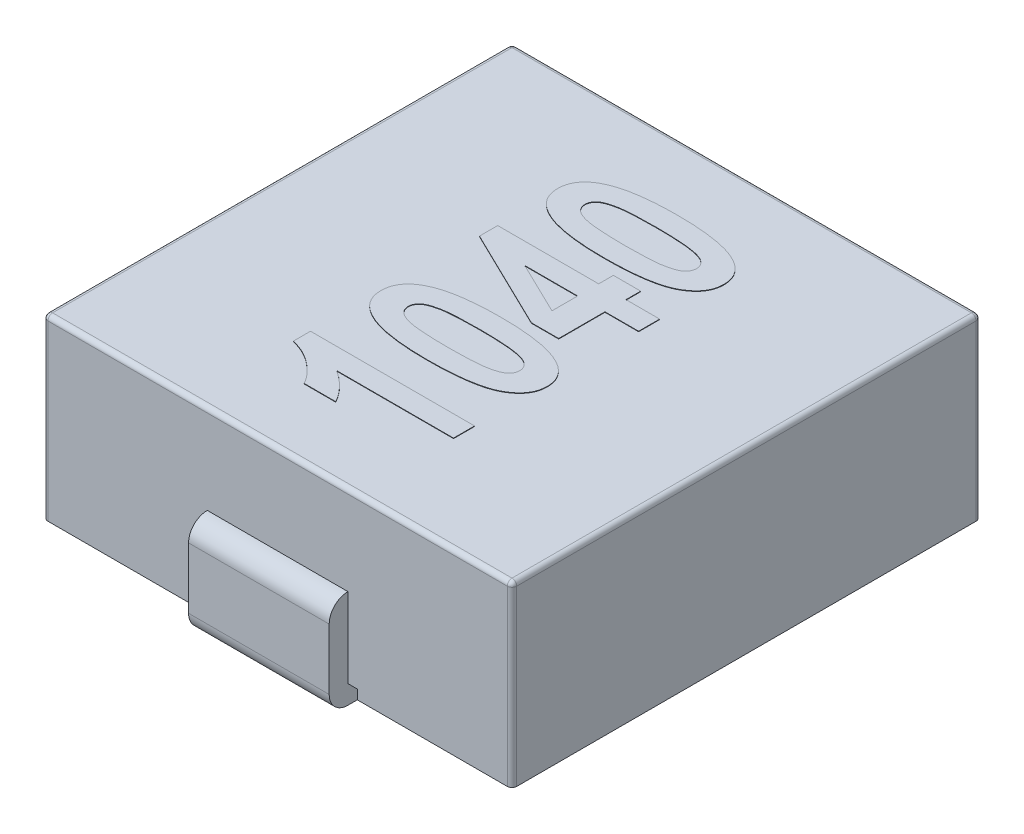
from build123d import *

# Parameters (mm, degrees)
EXTRUDE_1_DEPTH     = 3.8
SKETCH_2_W          = 3.4
SKETCH_2_H          = 2.5
CUT_EXTRUDE_1_DEPTH = 0.2
EXTRUDE_START       = -1.5
EXTRUDE_1_2_DEPTH   = 3
EXTRUDE_2_DEPTH     = 1.5
FILLET_1_R          = 0.1
EXTRUDE_2_2_DEPTH   = 0.01


# Read off the part's stored shape, not the designer's step: Вытянуть-Тонкостенный1
with BuildPart() as part:
    # Эскиз1 → Extrude 1 (new body)
    with BuildSketch(Plane(origin=(0, 0, 0), x_dir=(1, 0, 0), z_dir=(0, 1, 0))):
        with BuildLine():
            Line((-4.9, -5), (4.9, -5))
            ThreePointArc((4.9, -5), (4.970710678, -4.970710678), (5, -4.9))
            Line((5, -4.9), (5, 4.9))
            ThreePointArc((5, 4.9), (4.970710678, 4.970710678), (4.9, 5))
            Line((4.9, 5), (-4.9, 5))
            ThreePointArc((-4.9, 5), (-4.970710678, 4.970710678), (-5, 4.9))
            Line((-5, 4.9), (-5, -4.9))
            ThreePointArc((-5, -4.9), (-4.970710678, -4.970710678), (-4.9, -5))
        make_face()
    extrude(amount=EXTRUDE_1_DEPTH)

    # Эскиз2 → Вырез-Вытянуть1 (cut)
    with BuildSketch(Plane.XZ):
        with Locations((0, 3.75)):
            Rectangle(SKETCH_2_W, SKETCH_2_H)
        with Locations((0, -3.75)):
            Rectangle(SKETCH_2_W, SKETCH_2_H)
    extrude(amount=-CUT_EXTRUDE_1_DEPTH, mode=Mode.SUBTRACT)

    # Extrude 1 2 outline → Extrude 1 2 (add)
    with BuildSketch(Plane(origin=(0, 0, 0), x_dir=(0, 0, -1), z_dir=(1, 0, 0)).offset(EXTRUDE_START)):
        with BuildLine():
            Line((-5, -0.2), (-2.8, -0.2))
            Line((-2.8, -0.2), (-2.8, 0.2))
            Line((-2.8, 0.2), (-5, 0.2))
            Line((-5, 0.2), (-5, 1.9))
            ThreePointArc((-5, 1.9), (-5.282842712, 1.782842712), (-5.4, 1.5))
            Line((-5.4, 1.5), (-5.4, 0.2))
            ThreePointArc((-5.4, 0.2), (-5.282842712, -0.082842712), (-5, -0.2))
        make_face()
    extrude(amount=EXTRUDE_1_2_DEPTH)

    # Эскиз3<3> → Extrude 2 (add, symmetric)
    with BuildSketch(Plane(origin=(0, 0, 0), x_dir=(0, 0, -1), z_dir=(1, 0, 0))):
        with BuildLine():
            ThreePointArc((5, 1.9), (5.282842712, 1.782842712), (5.4, 1.5))
            Line((5.4, 1.5), (5.4, 0.2))
            ThreePointArc((5.4, 0.2), (5.282842712, -0.082842712), (5, -0.2))
            Line((5, -0.2), (2.8, -0.2))
            Line((2.8, -0.2), (2.8, 0.1))
            Line((2.8, 0.1), (5, 0.1))
            ThreePointArc((5, 0.1), (5.070710678, 0.129289322), (5.1, 0.2))
            Line((5.1, 0.2), (5.1, 1.5))
            ThreePointArc((5.1, 1.5), (5.070710678, 1.570710678), (5, 1.6))
            Line((5, 1.6), (5, 1.9))
        make_face()
    extrude(amount=EXTRUDE_2_DEPTH, both=True)

    # Скругление1
    fillet_1_edges = [part.edges().sort_by_distance(p)[0] for p in [
        (4.970710678, 3.8, 4.970710678),
        (5, 3.8, 0),
        (4.970710678, 3.8, -4.970710678),
        (0, 3.8, -5),
        (-4.970710678, 3.8, -4.970710678),
        (-5, 3.8, 0),
        (-4.970710678, 3.8, 4.970710678),
        (0, 3.8, 5),
    ]]
    fillet(fillet_1_edges, radius=FILLET_1_R)

    # Эскиз4 → Extrude 2 2 (add)
    # profile 1 of 4: a face of its own
    with BuildSketch(Plane(origin=(0, 3.8, 0), x_dir=(1, 0, 0), z_dir=(0, 1, 0))):
        with BuildLine():
            Line((1.7, -2.498717949), (1.7, -2.947435897))
            Line((1.7, -2.947435897), (-0.791786859, -2.947435897))
            add(Edge.make_bspline(
                [(-0.791786859, -2.947435897), (-0.760917125, -2.968112469), (-0.700134047, -3.00882502), (-0.614527269, -3.07524319), (-0.53445385, -3.143745701), (-0.460618296, -3.215124853), (-0.393792818, -3.289974458), (-0.332773702, -3.367275786), (-0.276721317, -3.446776955), (-0.245155308, -3.502907989), (-0.229487179, -3.530769231)],
                knots=[0, 0, 0, 0, 1.088938903, 2.144140856, 3.174129565, 4.177079366, 5.152313026, 6.113193535, 7.063463312, 8, 8, 8, 8], degree=3))
            Line((-0.229487179, -3.530769231), (-0.902564103, -3.530769231))
            add(Edge.make_bspline(
                [(-0.902564103, -3.530769231), (-0.919567376, -3.50035862), (-0.955945248, -3.435296251), (-1.030801377, -3.342112081), (-1.123502255, -3.244271043), (-1.233232584, -3.144696305), (-1.357623279, -3.049941186), (-1.495364475, -2.970397872), (-1.643242288, -2.906927009), (-1.74724769, -2.878447448), (-1.8, -2.864002404)],
                knots=[0, 0, 0, 0, 0.726974399, 1.555334676, 2.488102504, 3.542595408, 4.648227997, 5.748855716, 6.858202954, 8, 8, 8, 8], degree=3))
            Line((-1.8, -2.864002404), (-1.8, -2.498717949))
            Line((-1.8, -2.498717949), (1.7, -2.498717949))
        make_face()
    # profile 2 of 4: a face of its own
    with BuildSketch(Plane(origin=(0, 3.8, 0), x_dir=(1, 0, 0), z_dir=(0, 1, 0))):
        with BuildLine():
            add(Edge.make_bspline(
                [(-1.8, -0.995512821), (-1.798971924, -0.966914607), (-1.796956002, -0.910837285), (-1.779600489, -0.829288091), (-1.751216862, -0.752561345), (-1.711795807, -0.68053178), (-1.660204976, -0.613677259), (-1.597284904, -0.552260697), (-1.523884206, -0.494701152), (-1.468794364, -0.462483219), (-1.440324519, -0.445833333)],
                knots=[0, 0, 0, 0, 0.990335955, 1.941918091, 2.874803411, 3.817344592, 4.776447062, 5.790256201, 6.858027893, 8, 8, 8, 8], degree=3))
            add(Edge.make_bspline(
                [(-1.440324519, -0.445833333), (-1.402130188, -0.426528809), (-1.321999388, -0.386028374), (-1.187709872, -0.339590789), (-1.037086157, -0.299060997), (-0.868524307, -0.266712887), (-0.68273044, -0.240885852), (-0.479355206, -0.223434855), (-0.258602274, -0.211834206), (-0.105638786, -0.210795896), (-0.026161859, -0.21025641)],
                knots=[0, 0, 0, 0, 0.709320221, 1.488136996, 2.351578881, 3.296025925, 4.333503578, 5.462459271, 6.681541968, 8, 8, 8, 8], degree=3))
            add(Edge.make_bspline(
                [(-0.026161859, -0.21025641), (0.05307919, -0.210824103), (0.205804784, -0.211918247), (0.426373304, -0.223180419), (0.629445055, -0.241720823), (0.815233625, -0.267561741), (0.984158919, -0.299591623), (1.135426872, -0.340964394), (1.270229966, -0.388247058), (1.350954549, -0.428679187), (1.389403045, -0.447936699)],
                knots=[0, 0, 0, 0, 1.312995247, 2.530607339, 3.658553567, 4.690944312, 5.638052286, 6.505204614, 7.288040485, 8, 8, 8, 8], degree=3))
            add(Edge.make_bspline(
                [(1.389403045, -0.447936699), (1.417671142, -0.464309189), (1.472471595, -0.496048851), (1.544691292, -0.553503235), (1.606822563, -0.6145931), (1.657015487, -0.681370259), (1.697202104, -0.752510236), (1.724221763, -0.829474104), (1.741898473, -0.910808972), (1.743867589, -0.966905045), (1.744871795, -0.995512821)],
                knots=[0, 0, 0, 0, 1.137869452, 2.205870468, 3.208685347, 4.168824794, 5.110097778, 6.045991611, 7.003498256, 8, 8, 8, 8], degree=3))
            add(Edge.make_bspline(
                [(1.744871795, -0.995512821), (1.743647289, -1.02435746), (1.741232778, -1.081234051), (1.722415646, -1.164024254), (1.691837628, -1.242553143), (1.648669918, -1.316493961), (1.592807152, -1.385973125), (1.525230581, -1.451243689), (1.444998856, -1.511405076), (1.352901786, -1.568459546), (1.244441004, -1.619407144), (1.11768181, -1.66292085), (0.972198631, -1.699536647), (0.807708267, -1.729243129), (0.624476212, -1.752718041), (0.422108091, -1.769158929), (0.200862075, -1.778778331), (0.046998564, -1.780087223), (-0.033173077, -1.780769231)],
                knots=[0, 0, 0, 0, 0.645419361, 1.272654235, 1.890740253, 2.526238705, 3.181721312, 3.881207095, 4.624357118, 5.423188913, 6.303383115, 7.301411888, 8.41965395, 9.659608738, 11.042235928, 12.55465667, 14.204780156, 16, 16, 16, 16], degree=3))
            add(Edge.make_bspline(
                [(-0.033173077, -1.780769231), (-0.11194653, -1.780197023), (-0.263970923, -1.779092722), (-0.483607597, -1.767859218), (-0.686203027, -1.749246189), (-0.871542045, -1.723533427), (-1.040001609, -1.691454057), (-1.190755447, -1.649942427), (-1.325360919, -1.60278803), (-1.40608364, -1.562349502), (-1.44453125, -1.543088942)],
                knots=[0, 0, 0, 0, 1.309014685, 2.526259242, 3.653591092, 4.688959007, 5.634987019, 6.500893979, 7.285987363, 8, 8, 8, 8], degree=3))
            add(Edge.make_bspline(
                [(-1.44453125, -1.543088942), (-1.472799347, -1.526716452), (-1.5275998, -1.49497679), (-1.599819497, -1.437522406), (-1.661950768, -1.376432541), (-1.712143692, -1.309655382), (-1.75233031, -1.238515405), (-1.779349968, -1.161551537), (-1.797026678, -1.080216669), (-1.798995794, -1.024120596), (-1.8, -0.995512821)],
                knots=[0, 0, 0, 0, 1.137869452, 2.205870468, 3.208685347, 4.168824794, 5.110097778, 6.045991611, 7.003498256, 8, 8, 8, 8], degree=3))
        make_face()
        with BuildLine():
            add(Edge.make_bspline(
                [(-1.216666667, -0.995512821), (-1.215745048, -1.011064921), (-1.213932015, -1.04165943), (-1.198592912, -1.085849333), (-1.175563122, -1.127727203), (-1.141105366, -1.166499217), (-1.095196075, -1.202564571), (-1.033535276, -1.231690175), (-0.958865183, -1.259259208), (-0.90299898, -1.271968185), (-0.873116987, -1.278766026)],
                knots=[0, 0, 0, 0, 0.768301419, 1.511423193, 2.293981631, 3.122697422, 4.062851431, 5.165553188, 6.483896945, 8, 8, 8, 8], degree=3))
            add(Edge.make_bspline(
                [(-0.873116987, -1.278766026), (-0.850489284, -1.283227388), (-0.801716589, -1.292843594), (-0.722497454, -1.302581659), (-0.632508873, -1.311745177), (-0.53199064, -1.319433689), (-0.420695738, -1.324764299), (-0.298921694, -1.328880254), (-0.166167262, -1.331891109), (-0.074073691, -1.331996469), (-0.026161859, -1.332051282)],
                knots=[0, 0, 0, 0, 0.651153801, 1.403524111, 2.252701802, 3.205906422, 4.250081423, 5.399207061, 6.646933174, 8, 8, 8, 8], degree=3))
            add(Edge.make_bspline(
                [(-0.026161859, -1.332051282), (0.021514143, -1.33189763), (0.112898246, -1.331603115), (0.244041035, -1.329914246), (0.363439623, -1.3251569), (0.471494413, -1.321015869), (0.567740405, -1.313545311), (0.652482366, -1.306466714), (0.725446448, -1.296648014), (0.804835862, -1.282407671), (0.887789499, -1.261179959), (0.971876078, -1.233147142), (1.038054201, -1.202400204), (1.086750785, -1.166568236), (1.119905282, -1.126602127), (1.144729121, -1.086108629), (1.158506538, -1.041466318), (1.160515076, -1.011023821), (1.161538462, -0.995512821)],
                knots=[0, 0, 0, 0, 1.719125493, 3.295174371, 4.728653729, 6.027749307, 7.193722427, 8.209200284, 9.093511833, 9.847244241, 11.116477919, 12.177140384, 13.040196904, 13.737959363, 14.33574092, 14.902295054, 15.440699572, 16, 16, 16, 16], degree=3))
            add(Edge.make_bspline(
                [(1.161538462, -0.995512821), (1.160577401, -0.979975441), (1.158673007, -0.949187265), (1.143818537, -0.904778467), (1.120169783, -0.863220107), (1.086038426, -0.824460468), (1.039868021, -0.788612401), (0.978775112, -0.758273931), (0.9035286, -0.732076963), (0.847825036, -0.719171898), (0.817988782, -0.712259615)],
                knots=[0, 0, 0, 0, 0.768082461, 1.5219978, 2.294253708, 3.122733322, 4.062619397, 5.170279042, 6.484329019, 8, 8, 8, 8], degree=3))
            add(Edge.make_bspline(
                [(0.817988782, -0.712259615), (0.795360282, -0.707804259), (0.746813222, -0.698245763), (0.668074327, -0.688425668), (0.578783186, -0.67928305), (0.478734389, -0.671562497), (0.367670477, -0.666266981), (0.24589698, -0.662143775), (0.113376054, -0.659139874), (0.021516239, -0.659030913), (-0.026161859, -0.658974359)],
                knots=[0, 0, 0, 0, 0.653300683, 1.401587671, 2.246977283, 3.196722021, 4.244339712, 5.397254066, 6.649093985, 8, 8, 8, 8], degree=3))
            add(Edge.make_bspline(
                [(-0.026161859, -0.658974359), (-0.07383798, -0.659126054), (-0.165222309, -0.659416818), (-0.296597117, -0.661134313), (-0.416233946, -0.665825095), (-0.524510809, -0.670097668), (-0.621045787, -0.67722813), (-0.705934378, -0.685432537), (-0.779183469, -0.695011318), (-0.858252134, -0.70939426), (-0.941146101, -0.729727286), (-1.025035447, -0.758082591), (-1.091786848, -0.78859803), (-1.140967216, -0.824533807), (-1.17527507, -0.863963888), (-1.19878456, -0.90529264), (-1.213900248, -0.949386128), (-1.215734342, -0.979967433), (-1.216666667, -0.995512821)],
                knots=[0, 0, 0, 0, 1.716384617, 3.289920733, 4.729522976, 6.026547351, 7.190661509, 8.213695098, 9.09659675, 9.84912745, 11.106129692, 12.165101096, 13.03434735, 13.737722059, 14.340040505, 14.901483381, 15.441591289, 16, 16, 16, 16], degree=3))
        make_face(mode=Mode.SUBTRACT)
    # profile 3 of 4: a face of its own
    with BuildSketch(Plane(origin=(0, 3.8, 0), x_dir=(1, 0, 0), z_dir=(0, 1, 0))):
        Polygon((1.7, 1.001282051), (0.982051282, 1.001282051), (0.982051282, 0.014102564), (0.400821314, 0.014102564), (-1.755128205, 1.060877404), (-1.755128205, 1.45), (0.398717949, 1.45), (0.398717949, 1.764102564), (0.982051282, 1.764102564), (0.982051282, 1.45), (1.7, 1.45), align=None)
        Polygon((0.398717949, 1.001282051), (-0.729387019, 1.001282051), (0.398717949, 0.453004808), align=None, mode=Mode.SUBTRACT)
    # profile 4 of 4: a face of its own
    with BuildSketch(Plane(origin=(0, 3.8, 0), x_dir=(1, 0, 0), z_dir=(0, 1, 0))):
        with BuildLine():
            add(Edge.make_bspline(
                [(-1.8, 2.773717949), (-1.798971924, 2.802316162), (-1.796956002, 2.858393484), (-1.779600489, 2.939942678), (-1.751216862, 3.016669425), (-1.711795807, 3.088698989), (-1.660204976, 3.15555351), (-1.597284904, 3.216970073), (-1.523884206, 3.274529617), (-1.468794364, 3.30674755), (-1.440324519, 3.323397436)],
                knots=[0, 0, 0, 0, 0.990335955, 1.941918091, 2.874803411, 3.817344592, 4.776447062, 5.790256201, 6.858027893, 8, 8, 8, 8], degree=3))
            add(Edge.make_bspline(
                [(-1.440324519, 3.323397436), (-1.402130188, 3.342701961), (-1.321999388, 3.383202395), (-1.187709872, 3.42963998), (-1.037086157, 3.470169772), (-0.868524307, 3.502517882), (-0.68273044, 3.528344917), (-0.479355206, 3.545795914), (-0.258602274, 3.557396563), (-0.105638786, 3.558434873), (-0.026161859, 3.558974359)],
                knots=[0, 0, 0, 0, 0.709320221, 1.488136996, 2.351578881, 3.296025925, 4.333503578, 5.462459271, 6.681541968, 8, 8, 8, 8], degree=3))
            add(Edge.make_bspline(
                [(-0.026161859, 3.558974359), (0.05307919, 3.558406667), (0.205804784, 3.557312522), (0.426373304, 3.54605035), (0.629445055, 3.527509947), (0.815233625, 3.501669029), (0.984158919, 3.469639146), (1.135426872, 3.428266375), (1.270229966, 3.380983711), (1.350954549, 3.340551582), (1.389403045, 3.321294071)],
                knots=[0, 0, 0, 0, 1.312995247, 2.530607339, 3.658553567, 4.690944312, 5.638052286, 6.505204614, 7.288040485, 8, 8, 8, 8], degree=3))
            add(Edge.make_bspline(
                [(1.389403045, 3.321294071), (1.417671142, 3.304921581), (1.472471595, 3.273181919), (1.544691292, 3.215727534), (1.606822563, 3.154637669), (1.657015487, 3.087860511), (1.697202104, 3.016720534), (1.724221763, 2.939756666), (1.741898473, 2.858421797), (1.743867589, 2.802325725), (1.744871795, 2.773717949)],
                knots=[0, 0, 0, 0, 1.137869452, 2.205870468, 3.208685347, 4.168824794, 5.110097778, 6.045991611, 7.003498256, 8, 8, 8, 8], degree=3))
            add(Edge.make_bspline(
                [(1.744871795, 2.773717949), (1.743647289, 2.744873309), (1.741232778, 2.687996718), (1.722415646, 2.605206515), (1.691837628, 2.526677627), (1.648669918, 2.452736809), (1.592807152, 2.383257644), (1.525230581, 2.31798708), (1.444998856, 2.257825693), (1.352901786, 2.200771223), (1.244441004, 2.149823626), (1.11768181, 2.10630992), (0.972198631, 2.069694122), (0.807708267, 2.03998764), (0.624476212, 2.016512728), (0.422108091, 2.000071841), (0.200862075, 1.990452438), (0.046998564, 1.989143546), (-0.033173077, 1.988461538)],
                knots=[0, 0, 0, 0, 0.645419361, 1.272654235, 1.890740253, 2.526238705, 3.181721312, 3.881207095, 4.624357118, 5.423188913, 6.303383115, 7.301411888, 8.41965395, 9.659608738, 11.042235928, 12.55465667, 14.204780156, 16, 16, 16, 16], degree=3))
            add(Edge.make_bspline(
                [(-0.033173077, 1.988461538), (-0.11194653, 1.989033747), (-0.263970923, 1.990138047), (-0.483607597, 2.001371551), (-0.686203027, 2.01998458), (-0.871542045, 2.045697342), (-1.040001609, 2.077776712), (-1.190755447, 2.119288342), (-1.325360919, 2.166442739), (-1.40608364, 2.206881268), (-1.44453125, 2.226141827)],
                knots=[0, 0, 0, 0, 1.309014685, 2.526259242, 3.653591092, 4.688959007, 5.634987019, 6.500893979, 7.285987363, 8, 8, 8, 8], degree=3))
            add(Edge.make_bspline(
                [(-1.44453125, 2.226141827), (-1.472799347, 2.242514317), (-1.5275998, 2.274253979), (-1.599819497, 2.331708363), (-1.661950768, 2.392798228), (-1.712143692, 2.459575387), (-1.75233031, 2.530715364), (-1.779349968, 2.607679232), (-1.797026678, 2.6890141), (-1.798995794, 2.745110173), (-1.8, 2.773717949)],
                knots=[0, 0, 0, 0, 1.137869452, 2.205870468, 3.208685347, 4.168824794, 5.110097778, 6.045991611, 7.003498256, 8, 8, 8, 8], degree=3))
        make_face()
        with BuildLine():
            add(Edge.make_bspline(
                [(-1.216666667, 2.773717949), (-1.215745048, 2.758165848), (-1.213932015, 2.727571339), (-1.198592912, 2.683381436), (-1.175563122, 2.641503566), (-1.141105366, 2.602731552), (-1.095196075, 2.566666198), (-1.033535276, 2.537540594), (-0.958865183, 2.509971561), (-0.90299898, 2.497262585), (-0.873116987, 2.490464744)],
                knots=[0, 0, 0, 0, 0.768301419, 1.511423193, 2.293981631, 3.122697422, 4.062851431, 5.165553188, 6.483896945, 8, 8, 8, 8], degree=3))
            add(Edge.make_bspline(
                [(-0.873116987, 2.490464744), (-0.850489284, 2.486003381), (-0.801716589, 2.476387175), (-0.722497454, 2.46664911), (-0.632508873, 2.457485592), (-0.53199064, 2.44979708), (-0.420695738, 2.44446647), (-0.298921694, 2.440350516), (-0.166167262, 2.43733966), (-0.074073691, 2.437234301), (-0.026161859, 2.437179487)],
                knots=[0, 0, 0, 0, 0.651153801, 1.403524111, 2.252701802, 3.205906422, 4.250081423, 5.399207061, 6.646933174, 8, 8, 8, 8], degree=3))
            add(Edge.make_bspline(
                [(-0.026161859, 2.437179487), (0.021514143, 2.437333139), (0.112898246, 2.437627654), (0.244041035, 2.439316524), (0.363439623, 2.44407387), (0.471494413, 2.4482149), (0.567740405, 2.455685458), (0.652482366, 2.462764055), (0.725446448, 2.472582755), (0.804835862, 2.486823098), (0.887789499, 2.50805081), (0.971876078, 2.536083627), (1.038054201, 2.566830566), (1.086750785, 2.602662534), (1.119905282, 2.642628643), (1.144729121, 2.683122141), (1.158506538, 2.727764451), (1.160515076, 2.758206948), (1.161538462, 2.773717949)],
                knots=[0, 0, 0, 0, 1.719125493, 3.295174371, 4.728653729, 6.027749307, 7.193722427, 8.209200284, 9.093511833, 9.847244241, 11.116477919, 12.177140384, 13.040196904, 13.737959363, 14.33574092, 14.902295054, 15.440699572, 16, 16, 16, 16], degree=3))
            add(Edge.make_bspline(
                [(1.161538462, 2.773717949), (1.160577401, 2.789255329), (1.158673007, 2.820043505), (1.143818537, 2.864452303), (1.120169783, 2.906010662), (1.086038426, 2.944770301), (1.039868021, 2.980618368), (0.978775112, 3.010956839), (0.9035286, 3.037153806), (0.847825036, 3.050058871), (0.817988782, 3.056971154)],
                knots=[0, 0, 0, 0, 0.768082461, 1.5219978, 2.294253708, 3.122733322, 4.062619397, 5.170279042, 6.484329019, 8, 8, 8, 8], degree=3))
            add(Edge.make_bspline(
                [(0.817988782, 3.056971154), (0.795360282, 3.06142651), (0.746813222, 3.070985006), (0.668074327, 3.080805102), (0.578783186, 3.089947719), (0.478734389, 3.097668273), (0.367670477, 3.102963789), (0.24589698, 3.107086994), (0.113376054, 3.110090895), (0.021516239, 3.110199856), (-0.026161859, 3.11025641)],
                knots=[0, 0, 0, 0, 0.653300683, 1.401587671, 2.246977283, 3.196722021, 4.244339712, 5.397254066, 6.649093985, 8, 8, 8, 8], degree=3))
            add(Edge.make_bspline(
                [(-0.026161859, 3.11025641), (-0.07383798, 3.110104716), (-0.165222309, 3.109813951), (-0.296597117, 3.108096457), (-0.416233946, 3.103405674), (-0.524510809, 3.099133101), (-0.621045787, 3.09200264), (-0.705934378, 3.083798232), (-0.779183469, 3.074219451), (-0.858252134, 3.059836509), (-0.941146101, 3.039503483), (-1.025035447, 3.011148178), (-1.091786848, 2.98063274), (-1.140967216, 2.944696963), (-1.17527507, 2.905266881), (-1.19878456, 2.863938129), (-1.213900248, 2.819844642), (-1.215734342, 2.789263337), (-1.216666667, 2.773717949)],
                knots=[0, 0, 0, 0, 1.716384617, 3.289920733, 4.729522976, 6.026547351, 7.190661509, 8.213695098, 9.09659675, 9.84912745, 11.106129692, 12.165101096, 13.03434735, 13.737722059, 14.340040505, 14.901483381, 15.441591289, 16, 16, 16, 16], degree=3))
        make_face(mode=Mode.SUBTRACT)
    extrude(amount=EXTRUDE_2_2_DEPTH)


solid = part.part
